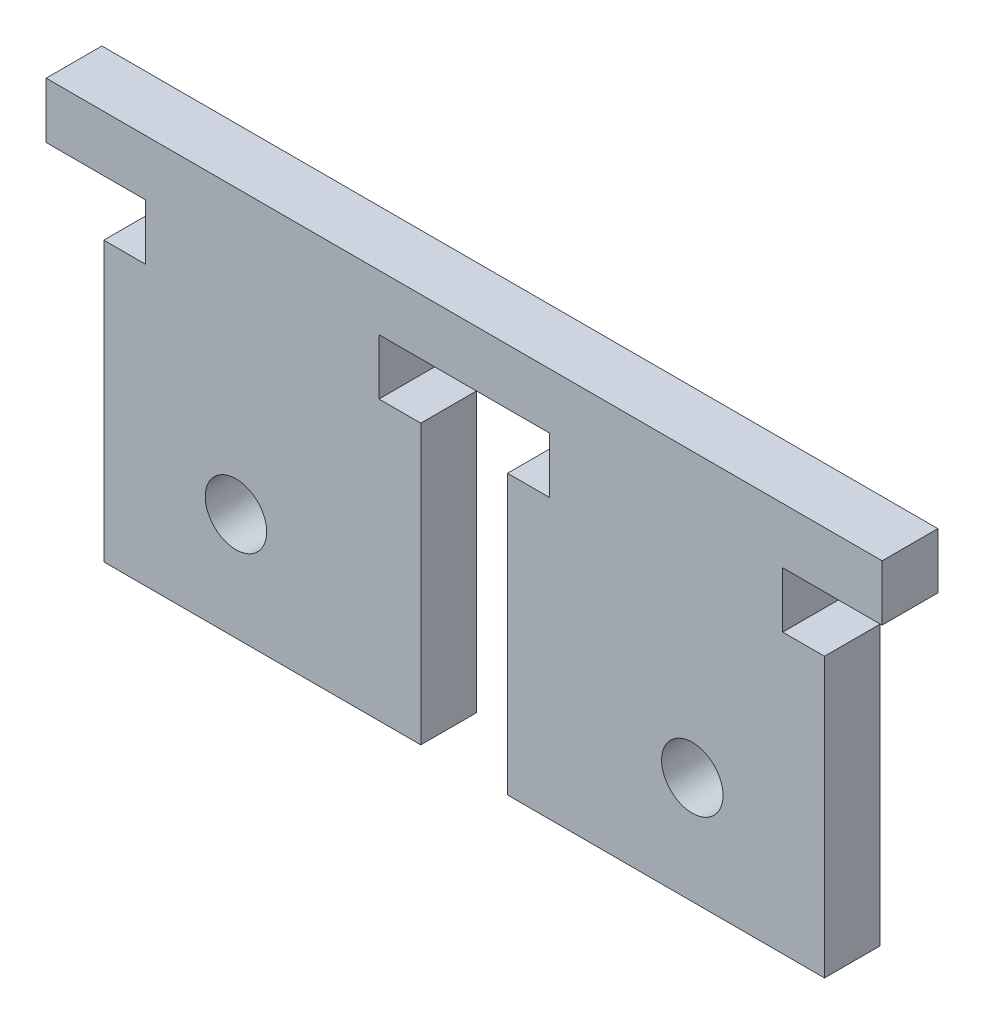
from build123d import *

# Parameters (mm, degrees)
SKETCH3_W            = 95.25
SKETCH3_H            = 60.96
BOSS_EXTRUDE1_DEPTH  = 6.35
SKETCH4_W            = 6.56336
SKETCH4_H            = 45.72
SKETCH4_W_2          = 9.8836988
CUT_EXTRUDE1_DEPTH   = 6.35
SKETCH5_W            = 4.7625
SKETCH5_H            = 6.35
CUT_EXTRUDE2_DEPTH   = 6.35
SKETCH9_W            = 95.25
SKETCH9_H            = 6.35
CUT_EXTRUDE6_DEPTH   = 8.89
SKETCH11_W           = 82.12328
SKETCH11_H           = 6.35
CUT_EXTRUDE9_DEPTH   = 7.62
M6_CLEARANCE_HOLE2_D = 7


with BuildPart() as part:
    # Sketch3 → Boss-Extrude1 (new body)
    with BuildSketch(Plane.XY):
        Rectangle(SKETCH3_W, SKETCH3_H)
    extrude(amount=BOSS_EXTRUDE1_DEPTH)

    # Sketch4 → Cut-Extrude1 (cut)
    with BuildSketch(Plane.XY.offset(6.35)):
        with Locations((-44.34332, -7.62)):
            Rectangle(SKETCH4_W, SKETCH4_H)
        with Locations((0, -7.62)):
            Rectangle(SKETCH4_W_2, SKETCH4_H)
        with Locations((44.34332, -7.62)):
            Rectangle(SKETCH4_W, SKETCH4_H)
    extrude(amount=-CUT_EXTRUDE1_DEPTH, mode=Mode.SUBTRACT)

    # Sketch5 → Cut-Extrude2 (cut)
    with BuildSketch(Plane.XY.offset(6.35)):
        with Locations((-7.3230994, 12.065)):
            Rectangle(SKETCH5_W, SKETCH5_H)
        with Locations((-38.68039, 12.065)):
            Rectangle(SKETCH5_W, SKETCH5_H)
    cut_extrude2 = extrude(amount=-CUT_EXTRUDE2_DEPTH, mode=Mode.SUBTRACT)

    # Mirror1: Cut-Extrude2 across plane
    add(cut_extrude2.mirror(Plane(origin=(0, 0, 0), x_dir=(0, 0, 1), z_dir=(1, 0, 0))), mode=Mode.SUBTRACT)

    # Sketch9 → Cut-Extrude6 (cut)
    with BuildSketch(Plane(origin=(0, 30.48, 0), x_dir=(1, 0, 0), z_dir=(0, 1, 0))):
        with Locations((0, -3.175)):
            Rectangle(SKETCH9_W, SKETCH9_H)
    extrude(amount=-CUT_EXTRUDE6_DEPTH, mode=Mode.SUBTRACT)

    # Sketch11 → Cut-Extrude9 (cut)
    with BuildSketch(Plane.XZ.offset(30.48)):
        with Locations((0, 3.175)):
            Rectangle(SKETCH11_W, SKETCH11_H)
    extrude(amount=-CUT_EXTRUDE9_DEPTH, mode=Mode.SUBTRACT)

    # M6 Clearance Hole2 (through all)
    with Locations(Plane.XY.offset(6.35)):
        with Locations((26, -10.6279), (-26, -10.6279)):
            Hole(M6_CLEARANCE_HOLE2_D / 2)


solid = part.part
